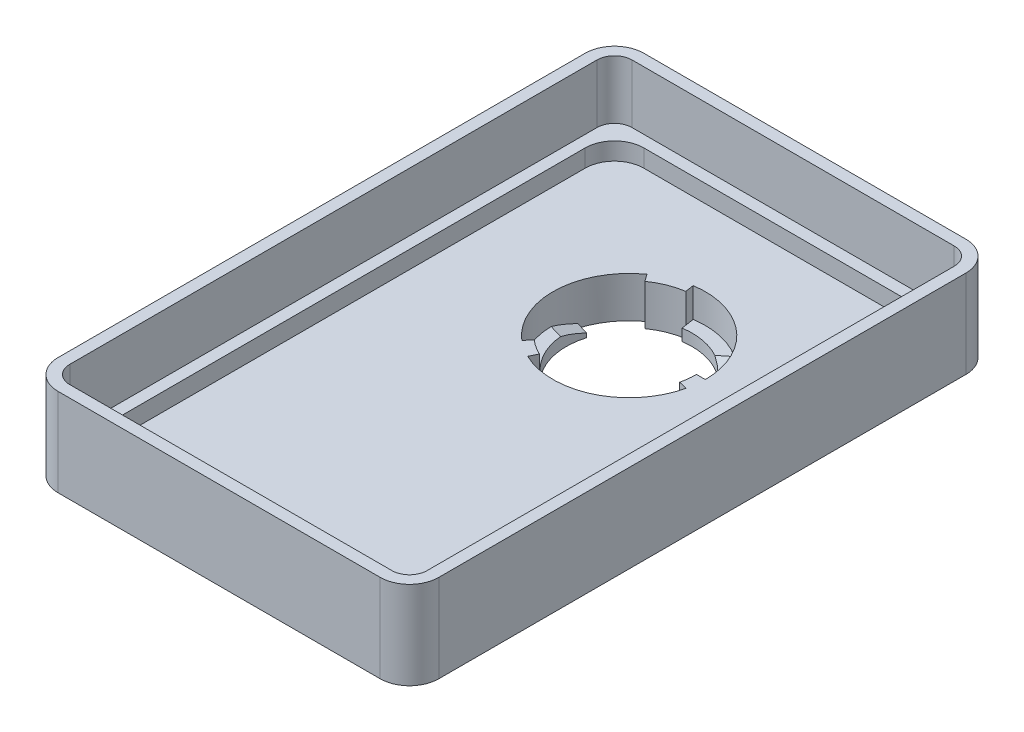
from build123d import *
from OCP.BRepFilletAPI import BRepFilletAPI_MakeChamfer

# Parameters (mm, degrees)
SKETCH1_W           = 65
SKETCH1_H           = 100
BOSS_EXTRUDE1_DEPTH = 2
SKETCH2_W           = 65
SKETCH2_H           = 100
SKETCH2_W_2         = 57
SKETCH2_H_2         = 92
BOSS_EXTRUDE2_DEPTH = 3
FILLET1_R           = 5
BOSS_EXTRUDE3_DEPTH = 10
SKETCH6_R           = 18
BOSS_EXTRUDE4_DEPTH = 5
CHAMFER1_SIZE       = 10
SKETCH7_R           = 13
CUT_EXTRUDE1_DEPTH  = 80.726093596
BOSS_EXTRUDE6_DEPTH = 2
BOSS_EXTRUDE7_DEPTH = 7
CHAMFER2_SIZE       = 1.3
CHAMFER2_SIZE2      = 4.000988598


with BuildPart() as part:
    # Sketch1 → Boss-Extrude1 (new body)
    with BuildSketch(Plane(origin=(0, 0, 0), x_dir=(1, 0, 0), z_dir=(0, 1, 0))):
        with Locations((0, -20)):
            Rectangle(SKETCH1_W, SKETCH1_H)
    extrude(amount=BOSS_EXTRUDE1_DEPTH)

    # Sketch2 → Boss-Extrude2 (add)
    with BuildSketch(Plane(origin=(0, 2, 0), x_dir=(1, 0, 0), z_dir=(0, 1, 0))):
        with Locations((0, -20)):
            Rectangle(SKETCH2_W, SKETCH2_H)
        with Locations((0, -20)):
            Rectangle(SKETCH2_W_2, SKETCH2_H_2, mode=Mode.SUBTRACT)
    extrude(amount=BOSS_EXTRUDE2_DEPTH)

    # Fillet1
    fillet1_edges = [part.edges().sort_by_distance(p)[0] for p in [
        (-28.5, 3.5, 66),
        (28.5, 3.5, 66),
        (28.5, 3.5, -26),
        (-28.5, 3.5, -26),
        (-32.5, 2.5, -30),
        (32.5, 2.5, -30),
        (32.5, 2.5, 70),
        (-32.5, 2.5, 70),
    ]]
    fillet(fillet1_edges, radius=FILLET1_R)

    # Sketch4 → Boss-Extrude3 (add)
    with BuildSketch(Plane(origin=(0, 5, 0), x_dir=(1, 0, 0), z_dir=(0, 1, 0))):
        with BuildLine():
            Line((-32.5, 25), (-32.5, -65))
            ThreePointArc((-32.5, -65), (-31.035533906, -68.535533906), (-27.5, -70))
            Line((-27.5, -70), (27.5, -70))
            ThreePointArc((27.5, -70), (31.035533906, -68.535533906), (32.5, -65))
            Line((32.5, -65), (32.5, 25))
            ThreePointArc((32.5, 25), (31.035533906, 28.535533906), (27.5, 30))
            Line((27.5, 30), (-27.5, 30))
            ThreePointArc((-27.5, 30), (-31.035533906, 28.535533906), (-32.5, 25))
        make_face()
        with BuildLine():
            Line((-30.5, 25), (-30.5, -65))
            ThreePointArc((-30.5, -65), (-29.621320344, -67.121320344), (-27.5, -68))
            Line((-27.5, -68), (27.5, -68))
            ThreePointArc((27.5, -68), (29.621320344, -67.121320344), (30.5, -65))
            Line((30.5, -65), (30.5, 25))
            ThreePointArc((30.5, 25), (29.621320344, 27.121320344), (27.5, 28))
            Line((27.5, 28), (-27.5, 28))
            ThreePointArc((-27.5, 28), (-29.621320344, 27.121320344), (-30.5, 25))
        make_face(mode=Mode.SUBTRACT)
    extrude(amount=BOSS_EXTRUDE3_DEPTH)

    # Sketch6 → Boss-Extrude4 (add)
    with BuildSketch(Plane(origin=(0, -5, 0), x_dir=(-1, 0, 0), z_dir=(0, -1, 0))):
        with Locations(Location((0, 0, 0), (0, 0, 90))):
            Circle(SKETCH6_R)
    extrude(amount=-BOSS_EXTRUDE4_DEPTH)

    # Chamfer1
    # the kernel refuses this chamfer: 10 mm, written as the material it adds along each edge
    with BuildSketch(Plane(origin=(0, 0, 0), x_dir=(0, 0, -1), z_dir=(-1, 0, 0))) as chamfer1_piece_1_section:
        Polygon((18 + CHAMFER1_SIZE, 0), (18, CHAMFER1_SIZE), (18, 0), align=None)
    chamfer1_piece_1 = revolve(axis=Axis((0, 0, 0), (0, -1, 0)), mode=Mode.PRIVATE)
    chamfer1_piece_1 = split(chamfer1_piece_1, bisect_by=Plane(origin=(0, -5, 25.515578953), z_dir=(0, 1, 0)), keep=Keep.TOP, mode=Mode.PRIVATE)
    add(chamfer1_piece_1)

    # Sketch7 → Cut-Extrude1 (cut, through all)
    with BuildSketch(Plane.XZ.offset(5)):
        with Locations(Location((0, 0, 0), (0, 0, 270))):
            Circle(SKETCH7_R)
    extrude(amount=-CUT_EXTRUDE1_DEPTH, mode=Mode.SUBTRACT)

    # Sketch8 → Boss-Extrude6 (add)
    with BuildSketch(Plane(origin=(0, -5, 0), x_dir=(-1, 0, 0), z_dir=(0, -1, 0))):
        with BuildLine():
            ThreePointArc((-8.942785339, 7.230255208), (-4.172190868, 10.71647439), (1.699808228, 11.373682429))
            Line((1.699808228, 11.373682429), (1.921522345, 12.857206224))
            ThreePointArc((1.921522345, 12.857206224), (-4.716389677, 12.114275398), (-10.109235601, 8.173331975))
            Line((-10.109235601, 8.173331975), (-8.942785339, 7.230255208))
        make_face()
        with BuildLine():
            Line((1.921522345, 12.857206224), (1.699808228, 11.373682429))
            ThreePointArc((1.699808228, 11.373682429), (4.307975824, 10.662614328), (6.678083991, 9.362328461))
            Line((6.678083991, 9.362328461), (7.549138424, 10.583501739))
            ThreePointArc((7.549138424, 10.583501739), (4.869885714, 12.053390109), (1.921522345, 12.857206224))
        make_face()
        with BuildLine():
            Line((12.464656553, 3.692199481), (11.026426951, 3.266176464))
            ThreePointArc((11.026426951, 3.266176464), (11.380990948, 1.650165153), (11.5, 0))
            ThreePointArc((11.5, 0), (10.443646499, -4.814586982), (7.468652556, -8.744668604))
            Line((7.468652556, -8.744668604), (8.442824628, -9.885277553))
            ThreePointArc((8.442824628, -9.885277553), (11.80586126, -5.442576588), (13, 0))
            ThreePointArc((13, 0), (12.865468029, 1.865404086), (12.464656553, 3.692199481))
        make_face()
        with BuildLine():
            ThreePointArc((7.468652556, -8.744668604), (6.263348903, -9.644711531), (4.950877613, -10.37973077))
            Line((4.950877613, -10.37973077), (5.596644259, -11.733608697))
            ThreePointArc((5.596644259, -11.733608697), (7.080307455, -10.902717383), (8.442824628, -9.885277553))
            Line((8.442824628, -9.885277553), (7.468652556, -8.744668604))
        make_face()
        with BuildLine():
            ThreePointArc((-8.359560208, 6.758716825), (-3.900091464, 10.017573887), (1.58895117, 10.631920531))
            Line((1.58895117, 10.631920531), (1.699808228, 11.373682429))
            ThreePointArc((1.699808228, 11.373682429), (-4.172190868, 10.71647439), (-8.942785339, 7.230255208))
            Line((-8.942785339, 7.230255208), (-8.359560208, 6.758716825))
        make_face()
        with BuildLine():
            Line((11.026426951, 3.266176464), (10.30731215, 3.053164956))
            ThreePointArc((10.30731215, 3.053164956), (10.638752408, 1.542545686), (10.75, 0))
            ThreePointArc((10.75, 0), (9.762539119, -4.500592179), (6.98156652, -8.17436413))
            Line((6.98156652, -8.17436413), (7.468652556, -8.744668604))
            ThreePointArc((7.468652556, -8.744668604), (10.443646499, -4.814586982), (11.5, 0))
            ThreePointArc((11.5, 0), (11.380990948, 1.650165153), (11.026426951, 3.266176464))
        make_face()
        with BuildLine():
            Line((-2.48051694, -12.761153385), (-2.194303447, -11.28871261))
            ThreePointArc((-2.194303447, -11.28871261), (-7.98857126, -8.272407704), (-11.205255745, -2.586937125))
            Line((-11.205255745, -2.586937125), (-12.666810842, -2.924363706))
            ThreePointArc((-12.666810842, -2.924363706), (-9.030558816, -9.351417404), (-2.48051694, -12.761153385))
        make_face()
        with BuildLine():
            Line((-2.194303447, -11.28871261), (-2.0511967, -10.552492222))
            ThreePointArc((-2.0511967, -10.552492222), (-7.467577482, -7.732902854), (-10.474478196, -2.418223834))
            Line((-10.474478196, -2.418223834), (-11.205255745, -2.586937125))
            ThreePointArc((-11.205255745, -2.586937125), (-7.98857126, -8.272407704), (-2.194303447, -11.28871261))
        make_face()
        with BuildLine():
            ThreePointArc((-11.205255745, -2.586937125), (-11.42607634, -1.301836958), (-11.5, 0))
            Line((-11.5, 0), (-13, 0))
            ThreePointArc((-13, 0), (-12.916434124, -1.471641779), (-12.666810842, -2.924363706))
            Line((-12.666810842, -2.924363706), (-11.205255745, -2.586937125))
        make_face()
    extrude(amount=-BOSS_EXTRUDE6_DEPTH)

    # Sketch8<5> → Boss-Extrude7 (add)
    with BuildSketch(Plane(origin=(0, -5, 0), x_dir=(-1, 0, 0), z_dir=(0, -1, 0))):
        with BuildLine():
            Line((1.921522345, 12.857206224), (1.699808228, 11.373682429))
            ThreePointArc((1.699808228, 11.373682429), (4.307975824, 10.662614328), (6.678083991, 9.362328461))
            Line((6.678083991, 9.362328461), (7.549138424, 10.583501739))
            ThreePointArc((7.549138424, 10.583501739), (4.869885714, 12.053390109), (1.921522345, 12.857206224))
        make_face()
        with BuildLine():
            ThreePointArc((7.468652556, -8.744668604), (6.263348903, -9.644711531), (4.950877613, -10.37973077))
            Line((4.950877613, -10.37973077), (5.596644259, -11.733608697))
            ThreePointArc((5.596644259, -11.733608697), (7.080307455, -10.902717383), (8.442824628, -9.885277553))
            Line((8.442824628, -9.885277553), (7.468652556, -8.744668604))
        make_face()
        with BuildLine():
            ThreePointArc((-11.205255745, -2.586937125), (-11.42607634, -1.301836958), (-11.5, 0))
            Line((-11.5, 0), (-13, 0))
            ThreePointArc((-13, 0), (-12.916434124, -1.471641779), (-12.666810842, -2.924363706))
            Line((-12.666810842, -2.924363706), (-11.205255745, -2.586937125))
        make_face()
    extrude(amount=-BOSS_EXTRUDE7_DEPTH)

    # Chamfer2: one chamfer whose edges measure the first distance from different faces: ONE call of the kernel's chamfer builder (chamfer() names one face for all edges)
    chamfer2_edges_1 = [part.edges().sort_by_distance(p)[0] for p in [
        (9.234397905, -3, -7.4660244),
    ]]
    chamfer2_side_1 = [part.faces().sort_by_distance(p)[0] for p in [
        (9.234397905, -4, -7.4660244),
    ]]
    chamfer2_edges_2 = [part.edges().sort_by_distance(p)[0] for p in [
        (-11.385984352, -3, -3.372682218),
    ]]
    chamfer2_side_2 = [part.faces().sort_by_distance(p)[0] for p in [
        (-11.385984352, -4, -3.372682218),
    ]]
    chamfer2_edges_3 = [part.edges().sort_by_distance(p)[0] for p in [
        (2.26585682, -3, 11.656822803),
    ]]
    chamfer2_side_3 = [part.faces().sort_by_distance(p)[0] for p in [
        (2.26585682, -4, 11.656822803),
    ]]
    chamfer2 = BRepFilletAPI_MakeChamfer(part.part.solid().wrapped)
    for e in chamfer2_edges_1:
        chamfer2.Add(CHAMFER2_SIZE, CHAMFER2_SIZE2, e.wrapped, chamfer2_side_1[0].wrapped)  # the first distance lies on this face
    for e in chamfer2_edges_2:
        chamfer2.Add(CHAMFER2_SIZE, CHAMFER2_SIZE2, e.wrapped, chamfer2_side_2[0].wrapped)  # the first distance lies on this face
    for e in chamfer2_edges_3:
        chamfer2.Add(CHAMFER2_SIZE, CHAMFER2_SIZE2, e.wrapped, chamfer2_side_3[0].wrapped)  # the first distance lies on this face
    add(Compound.cast(chamfer2.Shape()), mode=Mode.REPLACE)


solid = part.part
